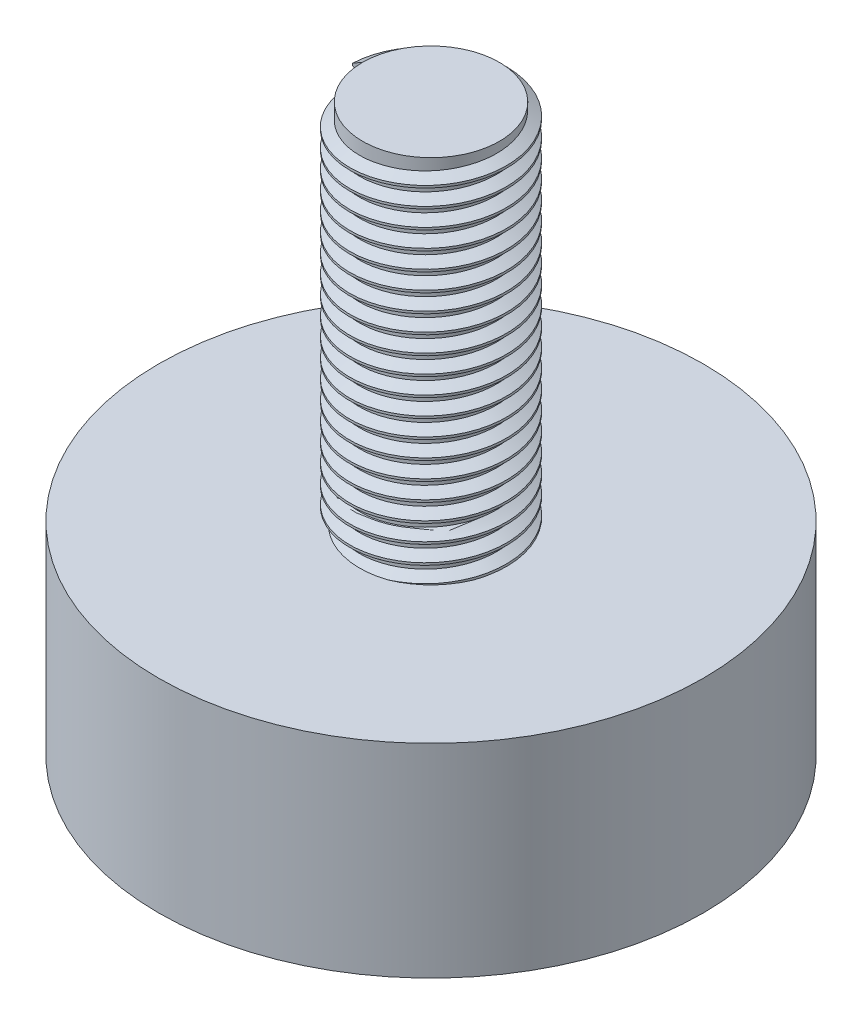
from build123d import *

# Parameters (mm, degrees)
ESQUISSE2_R        = 1.884737884
BOSS_EXTRU_1_DEPTH = 10
FILETAGE1_PITCH    = 0.5


with BuildPart() as part:
    # Esquisse1 → Révolution1 (revolve)
    with BuildSketch(Plane.XY, mode=Mode.PRIVATE) as r_volution1_sk:
        with BuildLine():
            Line((3.877427465, -0.0325), (7.5, 0))
            Line((7.5, 0), (7.5, 5.6))
            Line((7.5, 5.6), (0, 5.6))
            Line((0, 5.6), (0, 5.4))
            ThreePointArc((0, 5.4), (3.337158222, 3.681884758), (3.877427465, -0.0325))
        make_face()
    revolve(r_volution1_sk.sketch.rotate(Axis((0, 0, 0), (0, 1, 0)), 90), axis=Axis((0, 0, 0), (0, 1, 0)))

    # Esquisse2 → Boss.-Extru.1 (add)
    with BuildSketch(Plane(origin=(0, 5.6, 0), x_dir=(1, 0, 0), z_dir=(0, 1, 0))):
        with Locations(Location((0, 0, 0), (0, 0, 270))):
            Circle(ESQUISSE2_R)
    extrude(amount=BOSS_EXTRU_1_DEPTH)

    # Filetage1: the profile of Profil de filetage1 profile screwed along a right-hand helix of 20 turns, 6 arcs to a turn; built about Z, then put on its axis
    filetage1_z = Axis((0, 0, 0), (0, 0, 1))
    filetage1_corners = [(1.884437884, 0, -0.000173205), (2.155370822, 0, 0.156249999), (2.155370822, 0, 0.218749999), (1.884437884, 0, 0.375173204)]
    with BuildLine(mode=Mode.PRIVATE) as filetage1_profile:
        Line(filetage1_corners[0], filetage1_corners[1])
        Line(filetage1_corners[1], filetage1_corners[2])
        Line(filetage1_corners[2], filetage1_corners[3])
        Line(filetage1_corners[3], filetage1_corners[0])
    filetage1_cap = Face(filetage1_profile.wire())
    filetage1_turn_angles = [0, 30, 60, 90, 120, 150, 180, 210, 240, 270, 300, 330, 360]
    filetage1_turn_weights = [1, 0.8660254037844387, 1, 0.8660254037844387, 1, 0.8660254037844387, 1, 0.8660254037844387, 1, 0.8660254037844387, 1, 0.8660254037844387, 1]
    filetage1_turn_rails = [Edge.make_bspline([Vector(p[0], p[1], 0).rotate(filetage1_z, filetage1_turn_angles[k]) / filetage1_turn_weights[k] + Vector(0, 0, p[2] + FILETAGE1_PITCH * filetage1_turn_angles[k] / 360) for k in range(13)], [0, 0, 0, 1, 1, 2, 2, 3, 3, 4, 4, 5, 5, 6, 6, 6], 2, filetage1_turn_weights) for p in filetage1_corners]
    filetage1_turn_sides = [Face.make_surface_from_curves(filetage1_turn_rails[p[0]], filetage1_turn_rails[p[1]]) for p in [(0, 1), (1, 2), (2, 3), (3, 0)]]
    filetage1 = Plane(origin=(0, 15.6, 0), x_dir=(-1, 0, 0), z_dir=(0, -1, 0)) * Solid(Shell([*[p.moved(Location((0, 0, FILETAGE1_PITCH * i))) for i in range(20) for p in filetage1_turn_sides], filetage1_cap, filetage1_cap.rotate(filetage1_z, 7200).moved(Location((0, 0, FILETAGE1_PITCH * 7200 / 360)))]))
    add(filetage1)


solid = part.part
